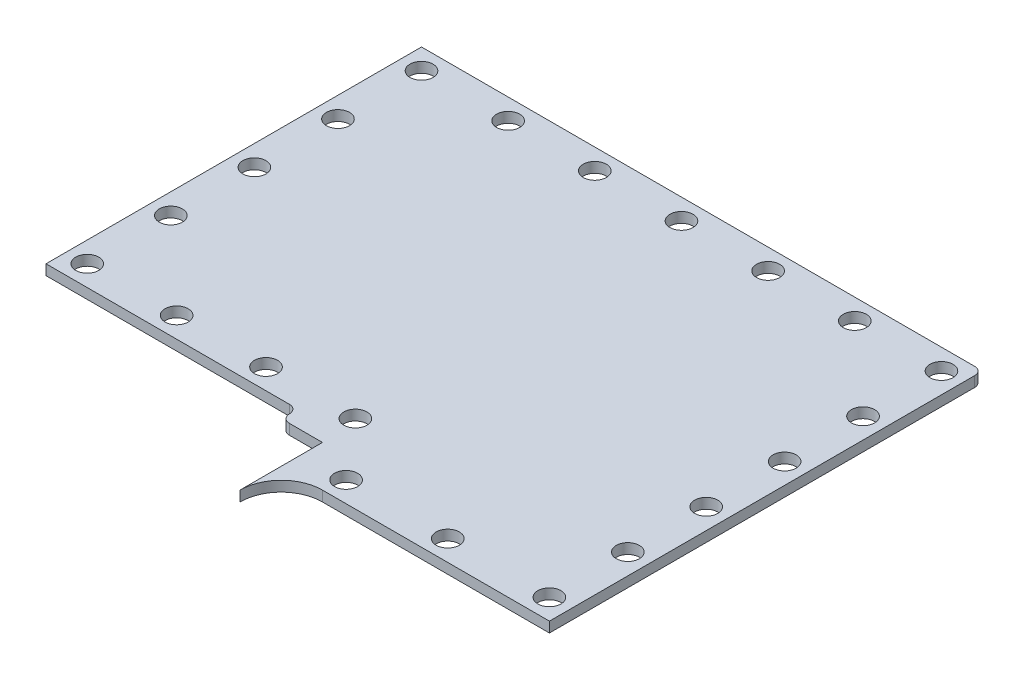
from build123d import *

# Parameters (mm, degrees)
BOSS_EXTRUDE1_DEPTH     = 1.5875
CUT_EXTRUDE1_DEPTH      = 86.176097722
CUT_EXTRUDE1_DEPTH_BACK = 86.176097722
SKETCH2_R               = 1.778


with BuildPart() as part:
    # Sketch1 → Boss-Extrude1 (new body)
    with BuildSketch(Plane(origin=(0, 0, 0), x_dir=(1, 0, 0), z_dir=(0, 1, 0))):
        with BuildLine():
            Line((8.89, -66.675), (43.815, -66.675))
            Line((43.815, -66.675), (43.815, -1.27))
            ThreePointArc((43.815, -1.27), (43.453523156, -0.361476844), (42.545, 0))
            Line((42.545, 0), (-42.545, 0))
            Line((-42.545, 0), (-42.545, -57.785))
            Line((-42.545, -57.785), (-5.08, -57.785))
            ThreePointArc((-5.08, -57.785), (-4.181974388, -58.156974388), (-3.81, -59.055))
            ThreePointArc((-3.81, -59.055), (-3.438025612, -59.953025612), (-2.54, -60.325))
            Line((-2.54, -60.325), (2.54, -60.325))
            Line((2.54, -60.325), (2.54, -73.025))
            ThreePointArc((2.54, -73.025), (4.399871939, -68.534871939), (8.89, -66.675))
        make_face()
    extrude(amount=BOSS_EXTRUDE1_DEPTH)

    # Sketch2 → Cut-Extrude1 (cut, two sides: drawn at the far end of the back side and taken through both)
    with BuildSketch(Plane(origin=(0, 1.5875, 0), x_dir=(-1, 0, 0), z_dir=(0, 1, 0)).offset(-CUT_EXTRUDE1_DEPTH_BACK)):
        with Locations((39.37, 3.175)):
            Circle(SKETCH2_R)
        with Locations((26.035, 3.175)):
            Circle(SKETCH2_R)
        with Locations((12.7, 3.175)):
            Circle(SKETCH2_R)
        with Locations((-0.635, 3.175)):
            Circle(SKETCH2_R)
        with Locations((-13.97, 3.175)):
            Circle(SKETCH2_R)
        with Locations((-27.305, 3.175)):
            Circle(SKETCH2_R)
        with Locations((-40.64, 3.175)):
            Circle(SKETCH2_R)
        with Locations((39.37, 16.03375)):
            Circle(SKETCH2_R)
        with Locations((39.37, 28.8925)):
            Circle(SKETCH2_R)
        with Locations((39.37, 41.75125)):
            Circle(SKETCH2_R)
        with Locations((-40.64, 15.24)):
            Circle(SKETCH2_R)
        with Locations((-40.64, 27.305)):
            Circle(SKETCH2_R)
        with Locations((-40.64, 39.37)):
            Circle(SKETCH2_R)
        with Locations((-40.64, 51.435)):
            Circle(SKETCH2_R)
        with Locations((-40.64, 63.5)):
            Circle(SKETCH2_R)
        with Locations((-24.994404736, 63.5)):
            Circle(SKETCH2_R)
        with Locations((-9.348809473, 63.5)):
            Circle(SKETCH2_R)
        with Locations((-1.889213751, 54.61)):
            Circle(SKETCH2_R)
        with Locations((11.863857499, 54.61)):
            Circle(SKETCH2_R)
        with Locations((25.61692875, 54.61)):
            Circle(SKETCH2_R)
        with Locations((39.37, 54.61)):
            Circle(SKETCH2_R)
    extrude(amount=CUT_EXTRUDE1_DEPTH + CUT_EXTRUDE1_DEPTH_BACK, mode=Mode.SUBTRACT)


solid = part.part
